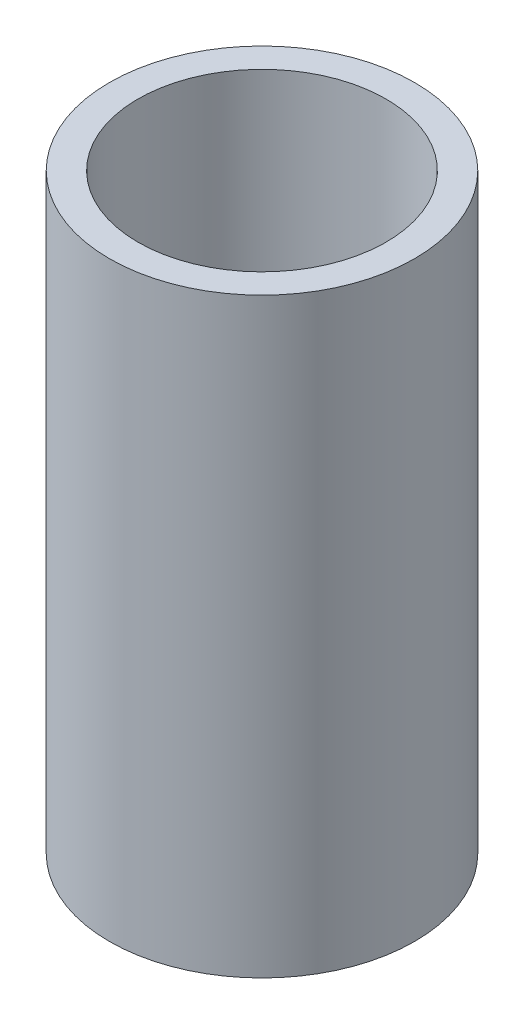
from build123d import *

# Parameters (mm, degrees)
SKETCH1_R           = 17.5
BOSS_EXTRUDE1_DEPTH = 67.820707518
SKETCH2_R           = 14.227141177
CUT_EXTRUDE1_DEPTH  = 73.195210147


with BuildPart() as part:
    # Sketch1 → Boss-Extrude1 (new body)
    with BuildSketch(Plane(origin=(0, 0, 0), x_dir=(1, 0, 0), z_dir=(0, 1, 0))):
        Circle(SKETCH1_R)
    extrude(amount=BOSS_EXTRUDE1_DEPTH)

    # Sketch2 → Cut-Extrude1 (cut, through all)
    with BuildSketch(Plane(origin=(0, 0, 0), x_dir=(1, 0, 0), z_dir=(0, 1, 0))):
        Circle(SKETCH2_R)
    extrude(amount=CUT_EXTRUDE1_DEPTH, mode=Mode.SUBTRACT)


solid = part.part
